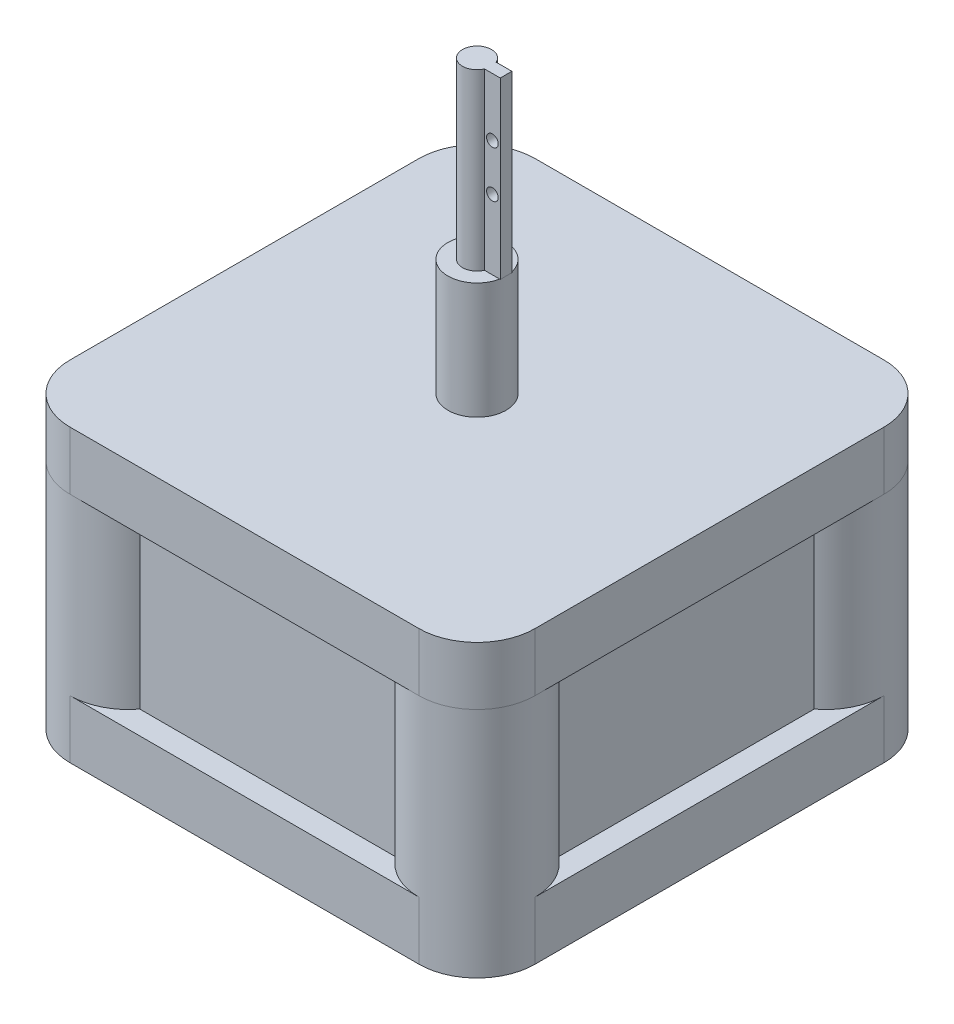
from build123d import *

# Parameters (mm, degrees)
SKETCH1_W           = 50.8
SKETCH1_H           = 50.8
BOSS_EXTRUDE1_DEPTH = 6.35
FILLET1_R           = 6.35
BOSS_EXTRUDE2_START = 19.05
BOSS_EXTRUDE2_DEPTH = 19.05
SKETCH5_W           = 50.8
SKETCH5_H           = 50.8
BOSS_EXTRUDE3_DEPTH = 6.35
FILLET2_R           = 6.35
SKETCH6_R           = 3.175
BOSS_EXTRUDE4_DEPTH = 12.7
BOSS_EXTRUDE5_DEPTH = 19.05
SKETCH8_R           = 0.635
CUT_EXTRUDE2_DEPTH  = 2.54


with BuildPart() as part:
    # Sketch1 → Boss-Extrude1 (new body)
    with BuildSketch(Plane(origin=(0, 0, 0), x_dir=(1, 0, 0), z_dir=(0, 1, 0))):
        with Locations((25.4, 25.4)):
            Rectangle(SKETCH1_W, SKETCH1_H)
    extrude(amount=BOSS_EXTRUDE1_DEPTH)

    # Fillet1
    fillet1_edges = [part.edges().sort_by_distance(p)[0] for p in [
        (0, 3.175, -50.8),
        (50.8, 3.175, -50.8),
        (50.8, 3.175, 0),
        (0, 3.175, 0),
    ]]
    fillet(fillet1_edges, radius=FILLET1_R)

    # Sketch3 → Boss-Extrude2 (add)
    with BuildSketch(Plane(origin=(0, 6.35, 0), x_dir=(1, 0, 0), z_dir=(0, 1, 0)).offset(BOSS_EXTRUDE2_START)):
        with BuildLine():
            Line((11.43, 48.26), (39.37, 48.26))
            ThreePointArc((39.37, 48.26), (48.940128061, 48.940128061), (48.26, 39.37))
            Line((48.26, 39.37), (48.26, 11.43))
            ThreePointArc((48.26, 11.43), (48.940128061, 1.859871939), (39.37, 2.54))
            Line((39.37, 2.54), (11.43, 2.54))
            ThreePointArc((11.43, 2.54), (1.859871939, 1.859871939), (2.54, 11.43))
            Line((2.54, 11.43), (2.54, 39.37))
            ThreePointArc((2.54, 39.37), (1.859871939, 48.940128061), (11.43, 48.26))
        make_face()
    extrude(amount=-BOSS_EXTRUDE2_DEPTH)

    # Sketch5 → Boss-Extrude3 (add)
    with BuildSketch(Plane(origin=(0, 25.4, 0), x_dir=(1, 0, 0), z_dir=(0, 1, 0))):
        with Locations((25.4, 25.4)):
            Rectangle(SKETCH5_W, SKETCH5_H)
    extrude(amount=BOSS_EXTRUDE3_DEPTH)

    # Fillet2
    fillet2_edges = [part.edges().sort_by_distance(p)[0] for p in [
        (50.8, 28.575, -50.8),
        (0, 28.575, -50.8),
        (50.8, 28.575, 0),
        (0, 28.575, 0),
    ]]
    fillet(fillet2_edges, radius=FILLET2_R - 0.0001)  # a hair under: the kernel refuses the full size

    # Sketch6 → Boss-Extrude4 (add)
    with BuildSketch(Plane(origin=(0, 31.75, 0), x_dir=(1, 0, 0), z_dir=(0, 1, 0))):
        with Locations(Location((25.4, 25.4, 0), (0, 0, 270))):
            Circle(SKETCH6_R)
    extrude(amount=BOSS_EXTRUDE4_DEPTH)

    # Sketch7 → Boss-Extrude5 (add)
    with BuildSketch(Plane(origin=(0, 44.45, 0), x_dir=(1, 0, 0), z_dir=(0, 1, 0))):
        with BuildLine():
            Line((28.575, 26.035), (28.575, 24.765))
            Line((28.575, 24.765), (26.854967783, 24.765))
            ThreePointArc((26.854967783, 24.765), (23.8125, 25.4), (26.854967783, 26.035))
            Line((26.854967783, 26.035), (28.575, 26.035))
        make_face()
    extrude(amount=BOSS_EXTRUDE5_DEPTH)

    # Sketch8 → Cut-Extrude2 (cut)
    with BuildSketch(Plane.XY.offset(-24.765)):
        with Locations((27.715591, 52.07)):
            Circle(SKETCH8_R)
        with Locations((27.715591, 57.15)):
            Circle(SKETCH8_R)
    extrude(amount=-CUT_EXTRUDE2_DEPTH, mode=Mode.SUBTRACT)


solid = part.part
